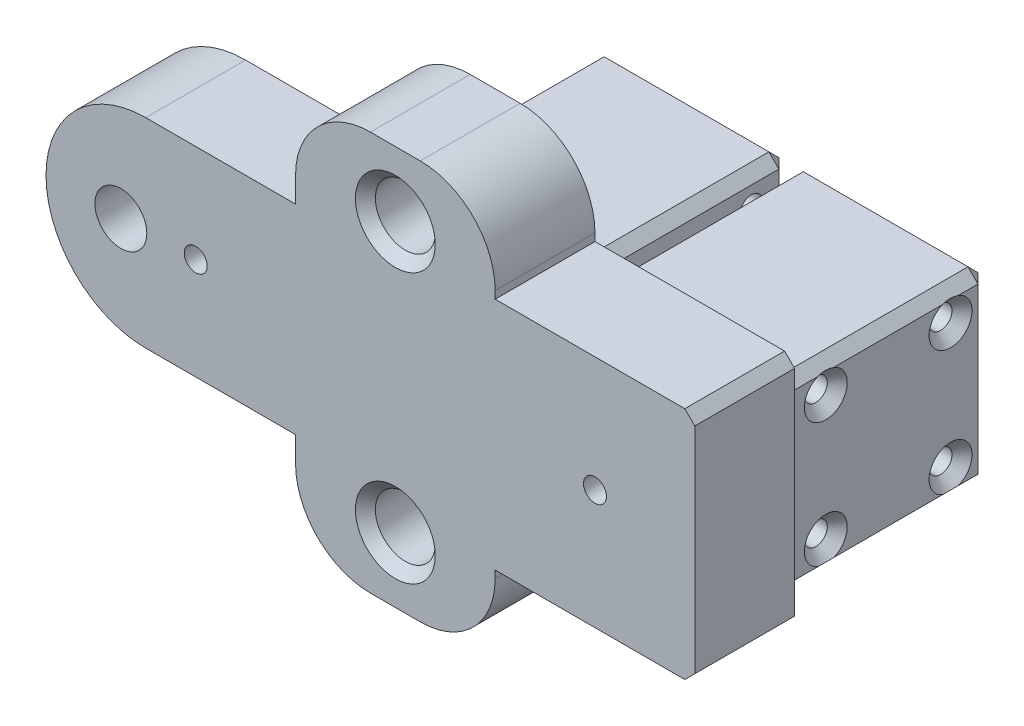
from build123d import *

# Parameters (mm, degrees)
SKETCH1_W               = 46.99
SKETCH1_H               = 46.99
BOSS_EXTRUDE2_DEPTH     = 50.8
SKETCH3_W               = 50.8
SKETCH3_H               = 59.69
BOSS_EXTRUDE3_DEPTH     = 25.4
SKETCH8_W               = 25.4
SKETCH8_H               = 50.8
BOSS_EXTRUDE4_DEPTH     = 114.3
SKETCH9_W               = 46.99
SKETCH9_H               = 46.99
BOSS_EXTRUDE5_DEPTH     = 50.8
CUT_EXTRUDE4_DEPTH      = 150.094227273
CUT_EXTRUDE4_DEPTH_BACK = 150.094227273
SKETCH4_R               = 2.921
SKETCH10_R              = 6.604
CUT_EXTRUDE5_DEPTH      = 150.094227273
FILLET2_R               = 25.4
SKETCH11_R              = 2.921
CUT_EXTRUDE6_DEPTH      = 150.094227273
SKETCH12_R              = 5.08
CUT_EXTRUDE7_DEPTH      = 57.15
SKETCH15_R              = 4.445
CUT_EXTRUDE8_DEPTH      = 12.7
SKETCH16_R              = 7.62
BOSS_EXTRUDE6_DEPTH     = 25.4


# Some blends are built 0.0001 mm under size
with BuildPart() as part:
    # Sketch1 → Boss-Extrude2 (new body)
    with BuildSketch(Plane.XY):
        with Locations((23.495, 23.495)):
            Rectangle(SKETCH1_W, SKETCH1_H)
    extrude(amount=BOSS_EXTRUDE2_DEPTH)

    # Sketch3 → Boss-Extrude3 (add)
    with BuildSketch(Plane.XY.offset(50.8)):
        with Locations((23.1775, 23.495)):
            Rectangle(SKETCH3_W, SKETCH3_H)
    extrude(amount=BOSS_EXTRUDE3_DEPTH)

    # Sketch8 → Boss-Extrude4 (add)
    with BuildSketch(Plane.ZY.offset(2.2225)):
        with Locations((63.5, 23.495)):
            Rectangle(SKETCH8_W, SKETCH8_H)
    extrude(amount=BOSS_EXTRUDE4_DEPTH)

    # Sketch9 → Boss-Extrude5 (add)
    with BuildSketch(Plane(origin=(0, 0, 50.8), x_dir=(-1, 0, 0), z_dir=(0, 0, -1))):
        with Locations((27.178, 23.495)):
            Rectangle(SKETCH9_W, SKETCH9_H)
    extrude(amount=BOSS_EXTRUDE5_DEPTH)

    # Sketch4 → Cut-Extrude4 (cut, two sides: drawn at the far end of the back side and taken through both)
    with BuildSketch(Plane.ZY.offset(-CUT_EXTRUDE4_DEPTH_BACK)):
        with Locations(Location((41.275, 39.37, 0), (0, 0, 90))):
            Circle(SKETCH4_R)
        with Locations(Location((41.275, 7.62, 0), (0, 0, 90))):
            Circle(SKETCH4_R)
        with Locations(Location((9.525, 7.62, 0), (0, 0, 90))):
            Circle(SKETCH4_R)
        with Locations(Location((9.525, 39.37, 0), (0, 0, 90))):
            Circle(SKETCH4_R)
    extrude(amount=CUT_EXTRUDE4_DEPTH + CUT_EXTRUDE4_DEPTH_BACK, mode=Mode.SUBTRACT)

    # Sketch10 → Cut-Extrude5 (cut, through all)
    with BuildSketch(Plane.XY.offset(76.2)):
        with Locations((-97.4725, 23.495)):
            Circle(SKETCH10_R)
    extrude(amount=-CUT_EXTRUDE5_DEPTH, mode=Mode.SUBTRACT)

    # Fillet2
    fillet2_edges = [part.edges().sort_by_distance(p)[0] for p in [
        (-116.5225, -1.905, 63.5),
        (-116.5225, 48.895, 63.5),
    ]]
    fillet(fillet2_edges, radius=FILLET2_R - 0.0001)  # a hair under: the kernel refuses the full size

    # Sketch11 → Cut-Extrude6 (cut, through all)
    with BuildSketch(Plane.XY.offset(76.2)):
        with Locations((23.1775, 23.987763641)):
            Circle(SKETCH11_R)
        with Locations((-27.6225, 23.987763641)):
            Circle(SKETCH11_R)
        with Locations((-78.4225, 23.987763641)):
            Circle(SKETCH11_R)
    extrude(amount=-CUT_EXTRUDE6_DEPTH, mode=Mode.SUBTRACT)

    # Sketch12 → Cut-Extrude7 (cut)
    with BuildSketch(Plane(origin=(0, 0, 0), x_dir=(-1, 0, 0), z_dir=(0, 0, -1))):
        with Locations((-23.1775, 23.987763641)):
            Circle(SKETCH12_R)
        with Locations((27.6225, 23.987763641)):
            Circle(SKETCH12_R)
    extrude(amount=-CUT_EXTRUDE7_DEPTH, mode=Mode.SUBTRACT)

    # Sketch15 → Cut-Extrude8 (cut)
    with BuildSketch(Plane(origin=(0, 0, 50.8), x_dir=(-1, 0, 0), z_dir=(0, 0, -1))):
        with Locations((78.4225, 23.987763641)):
            Circle(SKETCH15_R)
    extrude(amount=-CUT_EXTRUDE8_DEPTH, mode=Mode.SUBTRACT)

    # Sketch16 → Boss-Extrude6 (add)
    with BuildSketch(Plane.XY.offset(76.2)):
        with BuildLine():
            Line((-21.2725, 74.295), (-33.9725, 74.295))
            ThreePointArc((-33.9725, 74.295), (-47.442884182, 68.715384182), (-53.0225, 55.245))
            Line((-53.0225, 55.245), (-53.0225, -8.255))
            ThreePointArc((-53.0225, -8.255), (-47.442884182, -21.725384182), (-33.9725, -27.305))
            Line((-33.9725, -27.305), (-21.2725, -27.305))
            ThreePointArc((-21.2725, -27.305), (-7.802115818, -21.725384182), (-2.2225, -8.255))
            Line((-2.2225, -8.255), (-2.2225, 55.245))
            ThreePointArc((-2.2225, 55.245), (-7.802115818, 68.715384182), (-21.2725, 74.295))
        make_face()
        with Locations((-27.6225, 57.785)):
            Circle(SKETCH16_R, mode=Mode.SUBTRACT)
        with Locations((-27.6225, -10.795)):
            Circle(SKETCH16_R, mode=Mode.SUBTRACT)
    extrude(amount=-BOSS_EXTRUDE6_DEPTH)

    # Chamfer1
    # the kernel refuses this chamfer: 2.54 mm, written as the material it takes off along each edge
    with BuildSketch(Plane(origin=(-5.376333333, 45.296666667, 1.693333333), x_dir=(0.7071067811865476, -0.7071067811865476, 0), z_dir=(0.5773502691896255, 0.5773502691896256, -0.577350269189626)), Plane(origin=(-5.376333333, 1.693333333, 1.693333333), x_dir=(-0.7071067811865475, -0.7071067811865476, 0), z_dir=(0.5773502691896258, -0.5773502691896256, -0.577350269189626)), Plane(origin=(1.693333333, 45.296666667, 1.693333333), x_dir=(0.7071067811865476, 0.7071067811865475, 0), z_dir=(-0.5773502691896258, 0.577350269189626, -0.5773502691896255)), Plane(origin=(1.693333333, 1.693333333, 1.693333333), x_dir=(-0.7071067811865477, 0.7071067811865474, 0), z_dir=(-0.5773502691896258, -0.577350269189626, -0.5773502691896255))) as chamfer1_piece_1:
        Polygon((-1.796051224, -1.036950658), (1.796051224, -1.036950658), (0, 2.073901316), align=None)
    extrude(amount=3.226233304, mode=Mode.SUBTRACT)
    with BuildSketch(Plane(origin=(-48.979666667, 1.693333333, 1.693333333), x_dir=(0.7071067811865474, -0.7071067811865478, 0), z_dir=(-0.5773502691896261, -0.5773502691896255, -0.5773502691896257)), Plane(origin=(-48.979666667, 45.296666667, 1.693333333), x_dir=(-0.7071067811865476, -0.7071067811865476, 0), z_dir=(-0.5773502691896257, 0.5773502691896257, -0.5773502691896257)), Plane(origin=(45.296666667, 45.296666667, 1.693333333), x_dir=(-0.7071067811865476, 0.7071067811865476, 0), z_dir=(0.5773502691896258, 0.5773502691896258, -0.5773502691896255)), Plane(origin=(45.296666667, 1.693333333, 1.693333333), x_dir=(0.7071067811865474, 0.7071067811865477, 0), z_dir=(0.5773502691896261, -0.5773502691896257, -0.5773502691896255))) as chamfer1_piece_2:
        Polygon((-1.796051224, 1.036950658), (1.796051224, 1.036950658), (0, -2.073901316), align=None)
    extrude(amount=3.226233304, mode=Mode.SUBTRACT)
    with BuildSketch(Plane(origin=(23.1775, 23.987763641, 0), x_dir=(-1, 0, 0), z_dir=(0, -1, 0))) as chamfer1_piece_3:
        with BuildLine():
            Line((7.691842049, 0.071842049), (5.008157951, -2.611842049))
            Line((5.008157951, -2.611842049), (4.957357951, -2.611842049))
            ThreePointArc((4.957357951, -2.611842049), (5.0292, -1.305921024), (5.0292, 0))
            Line((5.0292, 0), (5.08, 0.0508))
            ThreePointArc((5.08, 0.0508), (6.385921024, 0.0508), (7.691842049, 0.122642049))
            Line((7.691842049, 0.122642049), (7.691842049, 0.071842049))
        make_face()
    revolve(axis=Axis((23.1775, 23.987763641, 0), (0, 0, -1)), mode=Mode.SUBTRACT)
    with BuildSketch(Plane(origin=(-27.6225, 23.987763641, 0), x_dir=(-1, 0, 0), z_dir=(0, -1, 0))) as chamfer1_piece_4:
        with BuildLine():
            Line((7.691842049, 0.071842049), (5.008157951, -2.611842049))
            Line((5.008157951, -2.611842049), (4.957357951, -2.611842049))
            ThreePointArc((4.957357951, -2.611842049), (5.0292, -1.305921024), (5.0292, 0))
            Line((5.0292, 0), (5.08, 0.0508))
            ThreePointArc((5.08, 0.0508), (6.385921024, 0.0508), (7.691842049, 0.122642049))
            Line((7.691842049, 0.122642049), (7.691842049, 0.071842049))
        make_face()
    revolve(axis=Axis((-27.6225, 23.987763641, 0), (0, 0, -1)), mode=Mode.SUBTRACT)
    with BuildSketch(Plane(origin=(48.5775, -6.35, 44.267925211), x_dir=(0.02749587661058728, 0.9996219169112966, 0), z_dir=(0, 0, 1)), Plane(origin=(48.5775, 53.34, 44.267925211), x_dir=(-0.9996219169112968, 0.02749587661058727, 0), z_dir=(0, 0, 1))) as chamfer1_piece_5:
        with BuildLine():
            Line((2.612829916, 0), (-0.143629773, 2.608879196))
            Line((-0.143629773, 2.608879196), (-0.194410567, 2.607482405))
            ThreePointArc((-0.194410567, 2.607482405), (-0.086688237, 1.304030487), (-0.050780793, -0.001396791))
            Line((-0.050780793, -0.001396791), (0.001396791, -0.050780793))
            ThreePointArc((0.001396791, -0.050780793), (1.306824068, -0.01487335), (2.614226706, -0.050780793))
            Line((2.614226706, -0.050780793), (2.612829916, 0))
        make_face()
    extrude(amount=38.464149579, mode=Mode.SUBTRACT)
    with BuildSketch(Plane(origin=(-27.6225, -10.795, 50.8), x_dir=(1, 0, 0), z_dir=(0, -1, 0))) as chamfer1_piece_6:
        with BuildLine():
            Line((10.231842049, -0.071842049), (7.548157951, 2.611842049))
            Line((7.548157951, 2.611842049), (7.497357951, 2.611842049))
            ThreePointArc((7.497357951, 2.611842049), (7.5692, 1.305921024), (7.5692, 0))
            Line((7.5692, 0), (7.62, -0.0508))
            ThreePointArc((7.62, -0.0508), (8.925921024, -0.0508), (10.231842049, -0.122642049))
            Line((10.231842049, -0.122642049), (10.231842049, -0.071842049))
        make_face()
    revolve(axis=Axis((-27.6225, -10.795, 50.8), (0, 0, 1)), mode=Mode.SUBTRACT)
    with BuildSketch(Plane(origin=(-27.6225, 57.785, 50.8), x_dir=(1, 0, 0), z_dir=(0, -1, 0))) as chamfer1_piece_7:
        with BuildLine():
            Line((10.231842049, -0.071842049), (7.548157951, 2.611842049))
            Line((7.548157951, 2.611842049), (7.497357951, 2.611842049))
            ThreePointArc((7.497357951, 2.611842049), (7.5692, 1.305921024), (7.5692, 0))
            Line((7.5692, 0), (7.62, -0.0508))
            ThreePointArc((7.62, -0.0508), (8.925921024, -0.0508), (10.231842049, -0.122642049))
            Line((10.231842049, -0.122642049), (10.231842049, -0.071842049))
        make_face()
    revolve(axis=Axis((-27.6225, 57.785, 50.8), (0, 0, 1)), mode=Mode.SUBTRACT)
    with BuildSketch(Plane(origin=(-27.6225, 57.785, 76.2), x_dir=(1, 0, 0), z_dir=(0, -1, 0))) as chamfer1_piece_8:
        with BuildLine():
            Line((7.548157951, -2.611842049), (10.231842049, 0.071842049))
            Line((10.231842049, 0.071842049), (10.231842049, 0.122642049))
            ThreePointArc((10.231842049, 0.122642049), (8.925921024, 0.0508), (7.62, 0.0508))
            Line((7.62, 0.0508), (7.5692, 0))
            ThreePointArc((7.5692, 0), (7.5692, -1.305921024), (7.497357951, -2.611842049))
            Line((7.497357951, -2.611842049), (7.548157951, -2.611842049))
        make_face()
    revolve(axis=Axis((-27.6225, 57.785, 76.2), (0, 0, 1)), mode=Mode.SUBTRACT)
    with BuildSketch(Plane(origin=(-27.6225, -10.795, 76.2), x_dir=(1, 0, 0), z_dir=(0, -1, 0))) as chamfer1_piece_9:
        with BuildLine():
            Line((7.548157951, -2.611842049), (10.231842049, 0.071842049))
            Line((10.231842049, 0.071842049), (10.231842049, 0.122642049))
            ThreePointArc((10.231842049, 0.122642049), (8.925921024, 0.0508), (7.62, 0.0508))
            Line((7.62, 0.0508), (7.5692, 0))
            ThreePointArc((7.5692, 0), (7.5692, -1.305921024), (7.497357951, -2.611842049))
            Line((7.497357951, -2.611842049), (7.548157951, -2.611842049))
        make_face()
    revolve(axis=Axis((-27.6225, -10.795, 76.2), (0, 0, 1)), mode=Mode.SUBTRACT)
    with BuildSketch(Plane(origin=(-3.683, 46.99, 50.8), x_dir=(-0.9996219169112968, 0.027495876610587295, 0), z_dir=(0, 0, -1)), Plane(origin=(-3.683, 0, 50.8), x_dir=(0.027495876610586605, 0.9996219169112968, 0), z_dir=(0, 0, -1)), Plane(origin=(46.99, 46.99, -6.532074789), x_dir=(0.027495876610587267, -0.9996219169112966, 0), z_dir=(0, 0, 1)), Plane(origin=(46.99, 0, -6.532074789), x_dir=(-0.9996219169112968, -0.02749587661058637, 0), z_dir=(0, 0, 1))) as chamfer1_piece_10:
        with BuildLine():
            Line((2.612829916, 0), (-0.143629773, -2.608879196))
            Line((-0.143629773, -2.608879196), (-0.194410567, -2.607482405))
            ThreePointArc((-0.194410567, -2.607482405), (-0.086688237, -1.304030487), (-0.050780793, 0.001396791))
            Line((-0.050780793, 0.001396791), (0.001396791, 0.050780793))
            ThreePointArc((0.001396791, 0.050780793), (1.306824068, 0.01487335), (2.614226706, 0.050780793))
            Line((2.614226706, 0.050780793), (2.612829916, 0))
        make_face()
    extrude(amount=57.332074789, mode=Mode.SUBTRACT)
    with BuildSketch(Plane(origin=(-50.673, 0, 50.8), x_dir=(-0.02749587661058728, 0.9996219169112968, 0), z_dir=(0, 0, -1)), Plane(origin=(-50.673, 46.99, 50.8), x_dir=(0.9996219169112968, 0.02749587661058727, 0), z_dir=(0, 0, -1)), Plane(origin=(0, 46.99, -6.532074789), x_dir=(-0.02749587661058636, -0.9996219169112968, 0), z_dir=(0, 0, 1)), Plane(origin=(0, 0, -6.532074789), x_dir=(0.9996219169112966, -0.02749587661058636, 0), z_dir=(0, 0, 1))) as chamfer1_piece_11:
        with BuildLine():
            Line((2.612829916, 0), (-0.143629773, 2.608879196))
            Line((-0.143629773, 2.608879196), (-0.194410567, 2.607482405))
            ThreePointArc((-0.194410567, 2.607482405), (-0.086688237, 1.304030487), (-0.050780793, -0.001396791))
            Line((-0.050780793, -0.001396791), (0.001396791, -0.050780793))
            ThreePointArc((0.001396791, -0.050780793), (1.306824068, -0.01487335), (2.614226706, -0.050780793))
            Line((2.614226706, -0.050780793), (2.612829916, 0))
        make_face()
    extrude(amount=57.332074789, mode=Mode.SUBTRACT)
    with BuildSketch(Plane(origin=(-3.683, -6.532074789, 0), x_dir=(0.027495876610586445, 0, 0.9996219169112968), z_dir=(0, 1, 0)), Plane(origin=(-57.205074789, 0, 0), x_dir=(0, -0.027495876610586386, 0.9996219169112968), z_dir=(1, 0, 0)), Plane(origin=(-50.673, 53.522074789, 0), x_dir=(-0.027495876610587295, 0, 0.9996219169112968), z_dir=(0, -1, 0)), Plane(origin=(2.849074789, 46.99, 0), x_dir=(0, 0.027495876610587295, 0.9996219169112968), z_dir=(-1, 0, 0)), Plane(origin=(53.522074789, 46.99, 0), x_dir=(0, 0.02749587661058728, 0.9996219169112966), z_dir=(-1, 0, 0)), Plane(origin=(46.99, -6.532074789, 0), x_dir=(0.02749587661058728, 0, 0.9996219169112966), z_dir=(0, 1, 0)), Plane(origin=(-6.532074789, 0, 0), x_dir=(0, -0.027495876610586365, 0.9996219169112968), z_dir=(1, 0, 0)), Plane(origin=(0, 53.522074789, 0), x_dir=(-0.027495876610586365, 0, 0.9996219169112968), z_dir=(0, -1, 0))) as chamfer1_piece_12:
        with BuildLine():
            Line((2.612829916, 0), (-0.143629773, -2.608879196))
            Line((-0.143629773, -2.608879196), (-0.194410567, -2.607482405))
            ThreePointArc((-0.194410567, -2.607482405), (-0.086688237, -1.304030487), (-0.050780793, 0.001396791))
            Line((-0.050780793, 0.001396791), (0.001396791, 0.050780793))
            ThreePointArc((0.001396791, 0.050780793), (1.306824068, 0.01487335), (2.614226706, 0.050780793))
            Line((2.614226706, 0.050780793), (2.612829916, 0))
        make_face()
    extrude(amount=60.054149579, mode=Mode.SUBTRACT)
    with BuildSketch(Plane(origin=(46.99, 39.37, 9.525), x_dir=(0, 1, 0), z_dir=(0, 0, 1))) as chamfer1_piece_13:
        with BuildLine():
            Line((5.532842049, -0.071842049), (2.849157951, 2.611842049))
            Line((2.849157951, 2.611842049), (2.798357951, 2.611842049))
            ThreePointArc((2.798357951, 2.611842049), (2.8702, 1.305921024), (2.8702, 0))
            Line((2.8702, 0), (2.921, -0.0508))
            ThreePointArc((2.921, -0.0508), (4.226921024, -0.0508), (5.532842049, -0.122642049))
            Line((5.532842049, -0.122642049), (5.532842049, -0.071842049))
        make_face()
    revolve(axis=Axis((46.99, 39.37, 9.525), (-1, 0, 0)), mode=Mode.SUBTRACT)
    with BuildSketch(Plane(origin=(-50.673, 39.37, 9.525), x_dir=(0, 1, 0), z_dir=(0, 0, -1))) as chamfer1_piece_14:
        with BuildLine():
            Line((5.532842049, -0.071842049), (2.849157951, 2.611842049))
            Line((2.849157951, 2.611842049), (2.798357951, 2.611842049))
            ThreePointArc((2.798357951, 2.611842049), (2.8702, 1.305921024), (2.8702, 0))
            Line((2.8702, 0), (2.921, -0.0508))
            ThreePointArc((2.921, -0.0508), (4.226921024, -0.0508), (5.532842049, -0.122642049))
            Line((5.532842049, -0.122642049), (5.532842049, -0.071842049))
        make_face()
    revolve(axis=Axis((-50.673, 39.37, 9.525), (1, 0, 0)), mode=Mode.SUBTRACT)
    with BuildSketch(Plane(origin=(46.99, 7.62, 9.525), x_dir=(0, 1, 0), z_dir=(0, 0, 1))) as chamfer1_piece_15:
        with BuildLine():
            Line((5.532842049, -0.071842049), (2.849157951, 2.611842049))
            Line((2.849157951, 2.611842049), (2.798357951, 2.611842049))
            ThreePointArc((2.798357951, 2.611842049), (2.8702, 1.305921024), (2.8702, 0))
            Line((2.8702, 0), (2.921, -0.0508))
            ThreePointArc((2.921, -0.0508), (4.226921024, -0.0508), (5.532842049, -0.122642049))
            Line((5.532842049, -0.122642049), (5.532842049, -0.071842049))
        make_face()
    revolve(axis=Axis((46.99, 7.62, 9.525), (-1, 0, 0)), mode=Mode.SUBTRACT)
    with BuildSketch(Plane(origin=(-50.673, 7.62, 9.525), x_dir=(0, 1, 0), z_dir=(0, 0, -1))) as chamfer1_piece_16:
        with BuildLine():
            Line((5.532842049, -0.071842049), (2.849157951, 2.611842049))
            Line((2.849157951, 2.611842049), (2.798357951, 2.611842049))
            ThreePointArc((2.798357951, 2.611842049), (2.8702, 1.305921024), (2.8702, 0))
            Line((2.8702, 0), (2.921, -0.0508))
            ThreePointArc((2.921, -0.0508), (4.226921024, -0.0508), (5.532842049, -0.122642049))
            Line((5.532842049, -0.122642049), (5.532842049, -0.071842049))
        make_face()
    revolve(axis=Axis((-50.673, 7.62, 9.525), (1, 0, 0)), mode=Mode.SUBTRACT)
    with BuildSketch(Plane(origin=(46.99, 7.62, 41.275), x_dir=(0, 1, 0), z_dir=(0, 0, 1))) as chamfer1_piece_17:
        with BuildLine():
            Line((5.532842049, -0.071842049), (2.849157951, 2.611842049))
            Line((2.849157951, 2.611842049), (2.798357951, 2.611842049))
            ThreePointArc((2.798357951, 2.611842049), (2.8702, 1.305921024), (2.8702, 0))
            Line((2.8702, 0), (2.921, -0.0508))
            ThreePointArc((2.921, -0.0508), (4.226921024, -0.0508), (5.532842049, -0.122642049))
            Line((5.532842049, -0.122642049), (5.532842049, -0.071842049))
        make_face()
    revolve(axis=Axis((46.99, 7.62, 41.275), (-1, 0, 0)), mode=Mode.SUBTRACT)
    with BuildSketch(Plane(origin=(-50.673, 7.62, 41.275), x_dir=(0, 1, 0), z_dir=(0, 0, -1))) as chamfer1_piece_18:
        with BuildLine():
            Line((5.532842049, -0.071842049), (2.849157951, 2.611842049))
            Line((2.849157951, 2.611842049), (2.798357951, 2.611842049))
            ThreePointArc((2.798357951, 2.611842049), (2.8702, 1.305921024), (2.8702, 0))
            Line((2.8702, 0), (2.921, -0.0508))
            ThreePointArc((2.921, -0.0508), (4.226921024, -0.0508), (5.532842049, -0.122642049))
            Line((5.532842049, -0.122642049), (5.532842049, -0.071842049))
        make_face()
    revolve(axis=Axis((-50.673, 7.62, 41.275), (1, 0, 0)), mode=Mode.SUBTRACT)
    with BuildSketch(Plane(origin=(46.99, 39.37, 41.275), x_dir=(0, 1, 0), z_dir=(0, 0, 1))) as chamfer1_piece_19:
        with BuildLine():
            Line((5.532842049, -0.071842049), (2.849157951, 2.611842049))
            Line((2.849157951, 2.611842049), (2.798357951, 2.611842049))
            ThreePointArc((2.798357951, 2.611842049), (2.8702, 1.305921024), (2.8702, 0))
            Line((2.8702, 0), (2.921, -0.0508))
            ThreePointArc((2.921, -0.0508), (4.226921024, -0.0508), (5.532842049, -0.122642049))
            Line((5.532842049, -0.122642049), (5.532842049, -0.071842049))
        make_face()
    revolve(axis=Axis((46.99, 39.37, 41.275), (-1, 0, 0)), mode=Mode.SUBTRACT)
    with BuildSketch(Plane(origin=(-50.673, 39.37, 41.275), x_dir=(0, 1, 0), z_dir=(0, 0, -1))) as chamfer1_piece_20:
        with BuildLine():
            Line((5.532842049, -0.071842049), (2.849157951, 2.611842049))
            Line((2.849157951, 2.611842049), (2.798357951, 2.611842049))
            ThreePointArc((2.798357951, 2.611842049), (2.8702, 1.305921024), (2.8702, 0))
            Line((2.8702, 0), (2.921, -0.0508))
            ThreePointArc((2.921, -0.0508), (4.226921024, -0.0508), (5.532842049, -0.122642049))
            Line((5.532842049, -0.122642049), (5.532842049, -0.071842049))
        make_face()
    revolve(axis=Axis((-50.673, 39.37, 41.275), (1, 0, 0)), mode=Mode.SUBTRACT)
    with BuildSketch(Plane(origin=(-97.4725, 23.495, 50.8), x_dir=(1, 0, 0), z_dir=(0, -1, 0))) as chamfer1_piece_21:
        with BuildLine():
            Line((9.215842049, -0.071842049), (6.532157951, 2.611842049))
            Line((6.532157951, 2.611842049), (6.481357951, 2.611842049))
            ThreePointArc((6.481357951, 2.611842049), (6.5532, 1.305921024), (6.5532, 0))
            Line((6.5532, 0), (6.604, -0.0508))
            ThreePointArc((6.604, -0.0508), (7.909921024, -0.0508), (9.215842049, -0.122642049))
            Line((9.215842049, -0.122642049), (9.215842049, -0.071842049))
        make_face()
    revolve(axis=Axis((-97.4725, 23.495, 50.8), (0, 0, 1)), mode=Mode.SUBTRACT)


solid = part.part
